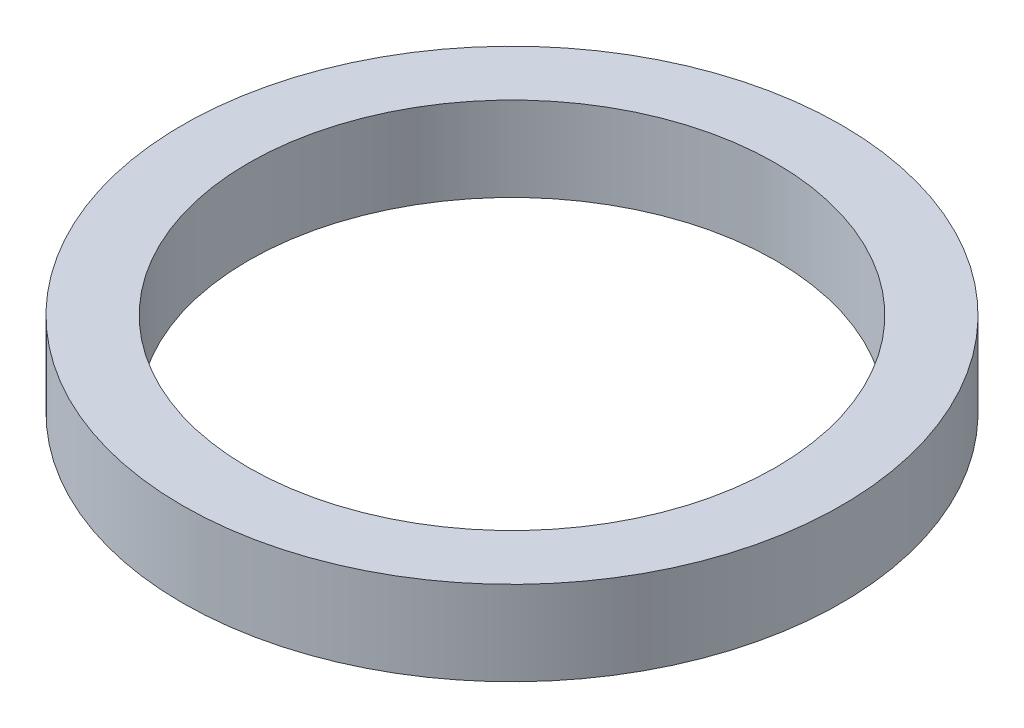
from build123d import *

# Parameters (mm, degrees)
SKETCH1_R           = 62.5
BOSS_EXTRUDE1_DEPTH = 16
SKETCH2_R           = 50
CUT_EXTRUDE1_DEPTH  = 90.824829529


with BuildPart() as part:
    # Sketch1 → Boss-Extrude1 (new body)
    with BuildSketch(Plane(origin=(0, 0, 0), x_dir=(1, 0, 0), z_dir=(0, 1, 0))):
        Circle(SKETCH1_R)
    extrude(amount=BOSS_EXTRUDE1_DEPTH)

    # Sketch2 → Cut-Extrude1 (cut, through all)
    with BuildSketch(Plane(origin=(0, 0, 0), x_dir=(1, 0, 0), z_dir=(0, 1, 0))):
        Circle(SKETCH2_R)
    extrude(amount=CUT_EXTRUDE1_DEPTH, mode=Mode.SUBTRACT)


solid = part.part
